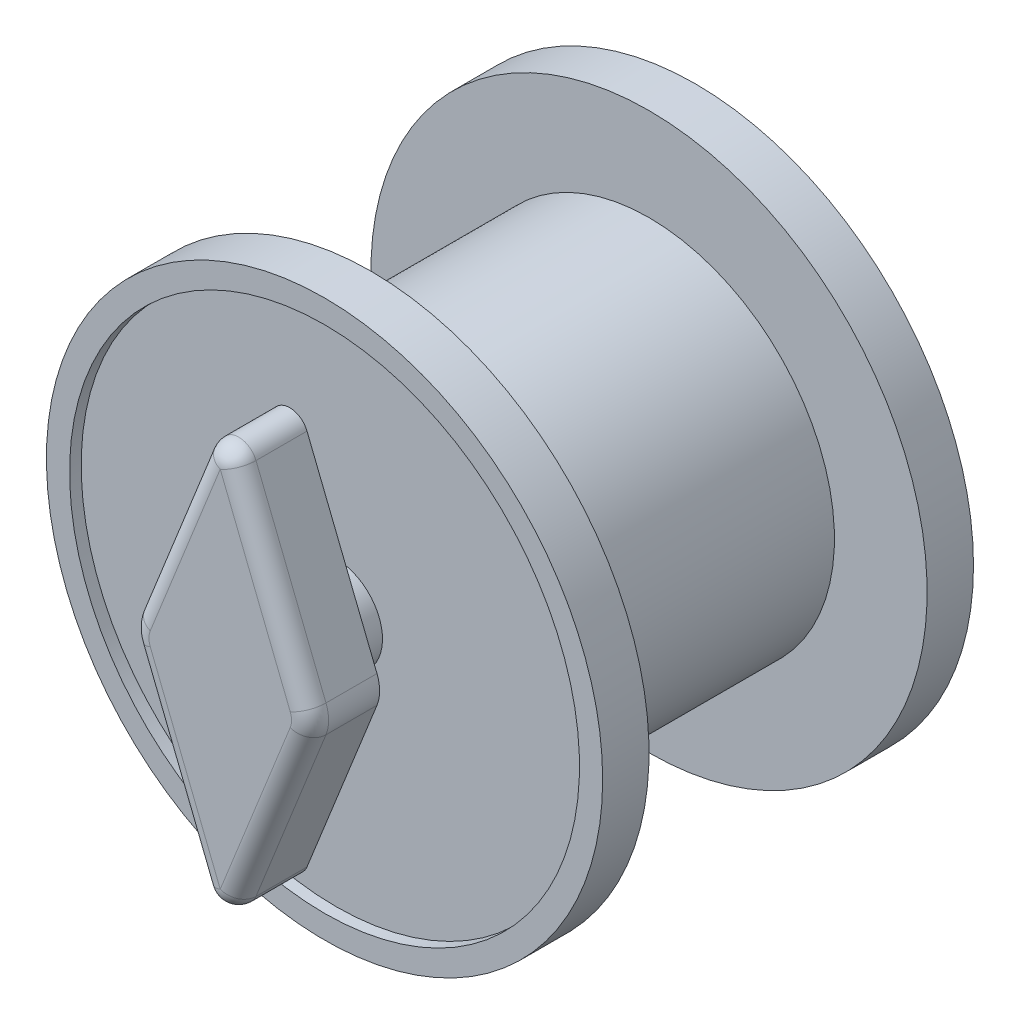
from build123d import *

# Parameters (mm, degrees)
SKETCH1_R           = 38.1
BOSS_EXTRUDE1_DEPTH = 50.8
SKETCH2_W           = 38.1
SKETCH2_H           = 12.7
SKETCH2_W_2         = 1.5875
SKETCH2_H_2         = 34.925
SKETCH4_R           = 6.35
BOSS_EXTRUDE2_DEPTH = 6.35
BOSS_EXTRUDE3_DEPTH = 9.525
FILLET1_R           = 2.54
SKETCH6_W           = 3.175
SKETCH6_H           = 12.7
CUT_EXTRUDE1_DEPTH  = 12.7
SHELL1_START        = 3.81
SHELL1_OUTLINE_R    = 22.86
SHELL1_OUTLINE_W    = 8.255
SHELL1_OUTLINE_H    = 17.78
SHELL1_DEPTH        = 42.8625
SHELL1_START_2      = 7.9375
SHELL1_2_OUTLINE_W  = 8.255
SHELL1_2_OUTLINE_H  = 17.78
SHELL1_2_DEPTH      = 38.735
SHELL1_START_3      = 58.1025
SHELL1_3_DEPTH      = 4.445
SHELL1_START_4      = 46.6725
SHELL1_4_OUTLINE_R  = 3.81
SHELL1_4_DEPTH      = 11.43
SHELL1_START_5      = -2.2225
SHELL1_6_OUTLINE_R  = 19.05
SHELL1_6_OUTLINE_W  = 8.255
SHELL1_6_OUTLINE_H  = 17.78
SHELL1_6_DEPTH      = 6.0325


with BuildPart() as part:
    # Sketch1 → Boss-Extrude1 (new body)
    with BuildSketch(Plane.XY):
        Circle(SKETCH1_R)
    extrude(amount=BOSS_EXTRUDE1_DEPTH)

    # Sketch2 → Cut-Revolve1 (revolve, cut)
    with BuildSketch(Plane(origin=(0, 0, 0), x_dir=(0, 0, -1), z_dir=(1, 0, 0))):
        with Locations((-25.4, 31.75)):
            Rectangle(SKETCH2_W, SKETCH2_H)
        with Locations((-0.79375, 17.4625)):
            Rectangle(SKETCH2_W_2, SKETCH2_H_2)
        with Locations((-50.00625, 17.4625)):
            Rectangle(SKETCH2_W_2, SKETCH2_H_2)
    revolve(axis=Axis((0, 0, 0), (0, 0, 1)), mode=Mode.SUBTRACT)

    # Sketch3 → Revolve1 (revolve)
    with BuildSketch(Plane(origin=(0, 0, 0), x_dir=(0, 0, -1), z_dir=(1, 0, 0))):
        with BuildLine():
            Line((4.7625, 19.05), (4.7625, 0))
            Line((4.7625, 0), (-1.5875, 0))
            Line((-1.5875, 0), (-1.5875, 25.4))
            Line((-1.5875, 25.4), (1.99026356, 23.575552712))
            ThreePointArc((1.99026356, 23.575552712), (4.014349425, 21.703578821), (4.7625, 19.05))
        make_face()
    revolve(axis=Axis((0, 0, -4.7625), (0, 0, 1)))

    # Sketch4 → Boss-Extrude2 (add)
    with BuildSketch(Plane.XY.offset(49.2125)):
        with Locations(Location((0, 0, 0), (0, 0, 90))):
            Circle(SKETCH4_R)
    extrude(amount=BOSS_EXTRUDE2_DEPTH)

    # Sketch5 → Boss-Extrude3 (add)
    with BuildSketch(Plane.XY.offset(55.5625)):
        with BuildLine():
            Line((-2.358330795, 25.854173013), (-11.945334146, 1.886664636))
            ThreePointArc((-11.945334146, 1.886664636), (-12.308672556, 0), (-11.945334146, -1.886664636))
            Line((-11.945334146, -1.886664636), (-2.358330795, -25.854173013))
            ThreePointArc((-2.358330795, -25.854173013), (0, -27.450840695), (2.358330795, -25.854173013))
            Line((2.358330795, -25.854173013), (11.945334146, -1.886664636))
            ThreePointArc((11.945334146, -1.886664636), (12.308672556, 0), (11.945334146, 1.886664636))
            Line((11.945334146, 1.886664636), (2.358330795, 25.854173013))
            ThreePointArc((2.358330795, 25.854173013), (0, 27.450840695), (-2.358330795, 25.854173013))
        make_face()
    extrude(amount=BOSS_EXTRUDE3_DEPTH)

    # Fillet1
    fillet1_edges = [part.edges().sort_by_distance(p)[0] for p in [
        (0, -27.450840695, 65.0875),
        (7.15183247, -13.870418824, 65.0875),
        (12.308672556, 0, 65.0875),
        (7.15183247, 13.870418824, 65.0875),
        (0, 27.450840695, 65.0875),
        (-7.15183247, 13.870418824, 65.0875),
        (-12.308672556, 0, 65.0875),
        (-7.15183247, -13.870418824, 65.0875),
    ]]
    fillet(fillet1_edges, radius=FILLET1_R)

    # Sketch6 → Cut-Extrude1 (cut)
    with BuildSketch(Plane(origin=(0, 0, -4.7625), x_dir=(-1, 0, 0), z_dir=(0, 0, -1))):
        Rectangle(SKETCH6_W, SKETCH6_H)
    extrude(amount=-CUT_EXTRUDE1_DEPTH, mode=Mode.SUBTRACT)

    # Shell1: read off the stored shape, not the designer's step
    # Shell1 outline → Shell1 (cut)
    with BuildSketch(Plane.XY.offset(SHELL1_START)):
        Circle(SHELL1_OUTLINE_R)
        Rectangle(SHELL1_OUTLINE_W, SHELL1_OUTLINE_H, mode=Mode.SUBTRACT)
    extrude(amount=SHELL1_DEPTH, mode=Mode.SUBTRACT)

    # Shell1 2 outline → Shell1 2 (cut)
    with BuildSketch(Plane.XY.offset(SHELL1_START_2)):
        Rectangle(SHELL1_2_OUTLINE_W, SHELL1_2_OUTLINE_H)
    extrude(amount=SHELL1_2_DEPTH, mode=Mode.SUBTRACT)

    # Shell1 3 outline → Shell1 3 (cut)
    with BuildSketch(Plane.XY.offset(SHELL1_START_3)):
        with BuildLine():
            Line((9.587003351, 0.943332318), (0, 24.910840695))
            Line((0, 24.910840695), (-9.587003351, 0.943332318))
            ThreePointArc((-9.587003351, 0.943332318), (-9.768672556, 0), (-9.587003351, -0.943332318))
            Line((-9.587003351, -0.943332318), (0, -24.910840695))
            Line((0, -24.910840695), (9.587003351, -0.943332318))
            ThreePointArc((9.587003351, -0.943332318), (9.768672556, 0), (9.587003351, 0.943332318))
        make_face()
    extrude(amount=SHELL1_3_DEPTH, mode=Mode.SUBTRACT)

    # Shell1 4 outline → Shell1 4 (cut)
    with BuildSketch(Plane.XY.offset(SHELL1_START_4)):
        Circle(SHELL1_4_OUTLINE_R)
    extrude(amount=SHELL1_4_DEPTH, mode=Mode.SUBTRACT)

    # Shell1 5 outline → Shell1 5 (revolve, cut)
    with BuildSketch(Plane.XZ):
        with BuildLine():
            ThreePointArc((19.05, -2.2225), (20.37678941, -1.848424713), (21.312776356, -0.83638178))
            Line((21.312776356, -0.83638178), (23.682155577, 3.81))
            Line((23.682155577, 3.81), (19.05, 3.81))
            Line((19.05, 3.81), (19.05, -2.2225))
        make_face()
    revolve(axis=Axis((0, 0, 0), (0, 0, 1)), mode=Mode.SUBTRACT)

    # Shell1 6 outline → Shell1 6 (cut)
    with BuildSketch(Plane.XY.offset(SHELL1_START_5)):
        Circle(SHELL1_6_OUTLINE_R)
        Rectangle(SHELL1_6_OUTLINE_W, SHELL1_6_OUTLINE_H, mode=Mode.SUBTRACT)
    extrude(amount=SHELL1_6_DEPTH, mode=Mode.SUBTRACT)


solid = part.part
